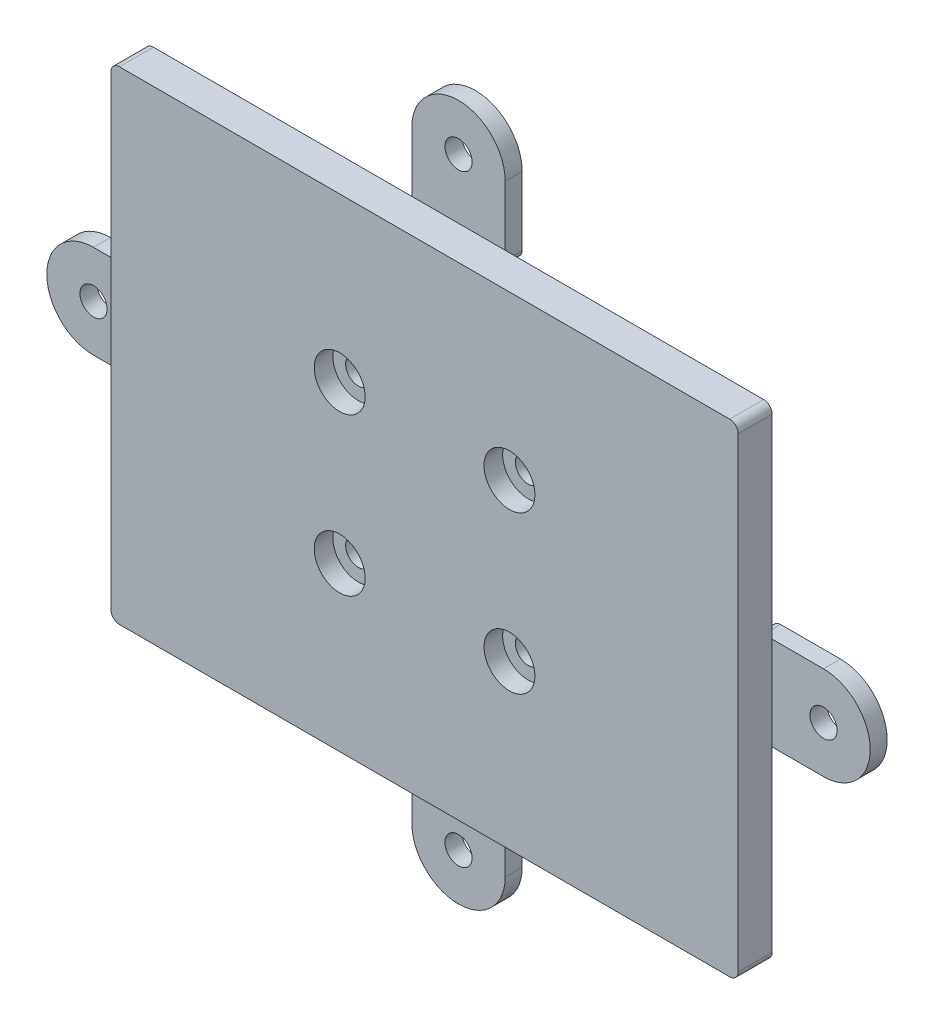
from build123d import *

# Parameters (mm, degrees)
SKETCH_1_W                = 73.9
SKETCH_1_H                = 56.9
EXTRUDE_1_DEPTH           = 4
HOLE_WIZARD_1_D           = 3
HOLE_WIZARD_1_CBORE_D     = 6
HOLE_WIZARD_1_CBORE_DEPTH = 2.2
SKETCH_4_W                = 7
SKETCH_4_H                = 25.95
SKETCH_4_W_2              = 33.45
SKETCH_4_H_2              = 7
SKETCH_4_H_3              = 23.95
EXTRUDE_2_DEPTH           = 2
HOLE_WIZARD_2_D           = 3.2
CHAMFER_1_SIZE            = 1
CHAMFER_1_SIZE_2          = 2
CHAMFER_2_SIZE            = 2
CHAMFER_2_SIZE_2          = 1
CHAMFER_3_SIZE            = 2
CHAMFER_3_SIZE_2          = 1
SKETCH_7_W                = 2
SKETCH_7_H                = 1
SKETCH_7_W_2              = 1
SKETCH_7_H_2              = 2
EXTRUDE_3_DEPTH           = 2
FILLET_3_R                = 1
FILLET_4_R                = 1


with BuildPart() as part:
    # 草图1 → 凸台-拉伸1 (new body)
    with BuildSketch(Plane.XY):
        Rectangle(SKETCH_1_W, SKETCH_1_H)
    extrude(amount=EXTRUDE_1_DEPTH)

    # 孔1 (through all)
    with Locations(Plane(origin=(-10, 9.25, 4), x_dir=(1, 0, 0), z_dir=(0, 0, 1))):
        with Locations((0, 0), (20, 0), (20, -18.5), (0, -18.5)):
            CounterBoreHole(HOLE_WIZARD_1_D / 2, HOLE_WIZARD_1_CBORE_D / 2, HOLE_WIZARD_1_CBORE_DEPTH)

    # 草图4 → 凸台-拉伸2 (add)
    with BuildSketch(Plane(origin=(0, 0, 0), x_dir=(-1, 0, 0), z_dir=(0, 0, -1))):
        with BuildLine():
            Line((3.5, 28.45), (3.5, 35.5))
            ThreePointArc((3.5, 35.5), (0, 39), (-3.5, 35.5))
            Line((-3.5, 35.5), (-3.5, 28.45))
            Line((-3.5, 28.45), (3.5, 28.45))
        make_face()
        with Locations((0, 15.475)):
            Rectangle(SKETCH_4_W, SKETCH_4_H)
        with Locations((20.225, -1)):
            Rectangle(SKETCH_4_W_2, SKETCH_4_H_2)
        with BuildLine():
            Line((43, 2.5), (36.95, 2.5))
            Line((36.95, 2.5), (36.95, -4.5))
            Line((36.95, -4.5), (43, -4.5))
            ThreePointArc((43, -4.5), (46.5, -1), (43, 2.5))
        make_face()
        with Locations((0, -1)):
            Rectangle(SKETCH_4_W, SKETCH_4_H_2)
        with Locations((-20.225, -1)):
            Rectangle(SKETCH_4_W_2, SKETCH_4_H_2)
        with Locations((0, -16.475)):
            Rectangle(SKETCH_4_W, SKETCH_4_H_3)
        with BuildLine():
            Line((-36.95, -4.5), (-36.95, 2.5))
            Line((-36.95, 2.5), (-43, 2.5))
            ThreePointArc((-43, 2.5), (-46.5, -1), (-43, -4.5))
            Line((-43, -4.5), (-36.95, -4.5))
        make_face()
        with BuildLine():
            Line((3.5, -35.5), (3.5, -28.45))
            Line((3.5, -28.45), (-3.5, -28.45))
            Line((-3.5, -28.45), (-3.5, -35.5))
            ThreePointArc((-3.5, -35.5), (0, -39), (3.5, -35.5))
        make_face()
    extrude(amount=EXTRUDE_2_DEPTH)

    # 孔2 (through all)
    with Locations(Plane(origin=(43, -1, -2), x_dir=(-1, 0, 0), z_dir=(0, 0, -1))):
        with Locations((0, 0), (43, 36.5), (86, 0), (43, -34.5)):
            Hole(HOLE_WIZARD_2_D / 2)

    # 倒角1
    # the kernel refuses this chamfer: 2, 1 mm, written as the material it adds along each edge
    with BuildSketch(Plane(origin=(-3.5, -2.679657748, 0), x_dir=(-0.9976223042390326, 0, 0.06891834360170879), z_dir=(0, 1, 0))) as chamfer_1_piece_1:
        Polygon((CHAMFER_1_SIZE * 0.997622304239, -CHAMFER_1_SIZE * 0.0689183436017), (-CHAMFER_1_SIZE_2 * 0.0689183436017, -CHAMFER_1_SIZE_2 * 0.997622304239), (0, 0), align=None)
    extrude(amount=31.129657748)
    with BuildSketch(Plane(origin=(-36.95, 2.5, 0), x_dir=(0, 0.9976223042390326, 0.06891834360170879), z_dir=(1, 0, 0))) as chamfer_1_piece_2:
        Polygon((CHAMFER_1_SIZE * 0.997622304239, -CHAMFER_1_SIZE * 0.0689183436017), (-CHAMFER_1_SIZE_2 * 0.0689183436017, -CHAMFER_1_SIZE_2 * 0.997622304239), (0, 0), align=None)
    extrude(amount=38.629657748)

    # 倒角2
    # the kernel refuses this chamfer: 2, 1 mm, written as the material it adds along each edge
    with BuildSketch(Plane(origin=(-3.5, 0.679657748, 0), x_dir=(0.017268075123668084, 0, -0.9998508956747119), z_dir=(0, -1, 0))) as chamfer_2_piece_1:
        Polygon((CHAMFER_2_SIZE * 0.999850895675, -CHAMFER_2_SIZE * 0.0172680751237), (-CHAMFER_2_SIZE_2 * 0.0172680751237, -CHAMFER_2_SIZE_2 * 0.999850895675), (0, 0), align=None)
    extrude(amount=29.129657748)
    with BuildSketch(Plane(origin=(-36.95, -4.5, 0), x_dir=(0, 0.017268075123667872, -0.9998508956747119), z_dir=(1, 0, 0))) as chamfer_2_piece_2:
        Polygon((CHAMFER_2_SIZE * 0.999850895675, -CHAMFER_2_SIZE * 0.0172680751237), (-CHAMFER_2_SIZE_2 * 0.0172680751237, -CHAMFER_2_SIZE_2 * 0.999850895675), (0, 0), align=None)
    extrude(amount=38.629657748)

    # 倒角3
    # the kernel refuses this chamfer: 2, 1 mm, written as the material it adds along each edge
    with BuildSketch(Plane(origin=(3.5, -28.45, 0), x_dir=(-0.0172680751236683, 0, -0.9998508956747119), z_dir=(0, 1, 0))) as chamfer_3_piece_1:
        Polygon((CHAMFER_3_SIZE * 0.999850895675, -CHAMFER_3_SIZE * 0.0172680751237), (-CHAMFER_3_SIZE_2 * 0.0172680751237, -CHAMFER_3_SIZE_2 * 0.999850895675), (0, 0), align=None)
    extrude(amount=29.129657748)
    with BuildSketch(Plane(origin=(-1.679657748, -4.5, 0), x_dir=(0, 0.0172680751236683, -0.9998508956747119), z_dir=(1, 0, 0)), Plane(origin=(36.95, 2.5, 0), x_dir=(0, -0.017268075123667872, -0.9998508956747119), z_dir=(-1, 0, 0))) as chamfer_3_piece_2:
        Polygon((CHAMFER_3_SIZE * 0.999850895675, -CHAMFER_3_SIZE * 0.0172680751237), (-CHAMFER_3_SIZE_2 * 0.0172680751237, -CHAMFER_3_SIZE_2 * 0.999850895675), (0, 0), align=None)
    extrude(amount=38.629657748)
    with BuildSketch(Plane(origin=(3.5, -2.679657748, 0), x_dir=(-0.017268075123668084, 0, -0.9998508956747119), z_dir=(0, 1, 0))) as chamfer_3_piece_3:
        Polygon((CHAMFER_3_SIZE * 0.999850895675, -CHAMFER_3_SIZE * 0.0172680751237), (-CHAMFER_3_SIZE_2 * 0.0172680751237, -CHAMFER_3_SIZE_2 * 0.999850895675), (0, 0), align=None)
    extrude(amount=31.129657748)

    # 草图7 → 凸台-拉伸3 (add)
    # profile 1 of 6: a face of its own
    with BuildSketch(Plane(origin=(0, 0, 0), x_dir=(-1, 0, 0), z_dir=(0, 0, -1))):
        with BuildLine():
            Line((-36.95, 4.5), (-43, 4.5))
            ThreePointArc((-43, 4.5), (-48.5, -1), (-43, -6.5))
            Line((-43, -6.5), (-34.95, -6.5))
            Line((-34.95, -6.5), (-34.95, 3.5))
            Line((-34.95, 3.5), (-36.95, 3.5))
            Line((-36.95, 3.5), (-36.95, 4.5))
        make_face()
        with BuildLine():
            Line((-43, 2.5), (-36.95, 2.5))
            Line((-36.95, 2.5), (-36.95, -4.5))
            Line((-36.95, -4.5), (-43, -4.5))
            ThreePointArc((-43, -4.5), (-46.5, -1), (-43, 2.5))
        make_face(mode=Mode.SUBTRACT)
    # profile 2 of 6: a face of its own
    with BuildSketch(Plane(origin=(0, 0, 0), x_dir=(-1, 0, 0), z_dir=(0, 0, -1))):
        with Locations((-35.95, 4)):
            Rectangle(SKETCH_7_W, SKETCH_7_H)
    # profile 3 of 6: a face of its own
    with BuildSketch(Plane(origin=(0, 0, 0), x_dir=(-1, 0, 0), z_dir=(0, 0, -1))):
        with BuildLine():
            Line((-5.5, -35.5), (-5.5, -26.45))
            Line((-5.5, -26.45), (5.5, -26.45))
            Line((5.5, -26.45), (5.5, -35.5))
            ThreePointArc((5.5, -35.5), (0, -41), (-5.5, -35.5))
        make_face()
        with BuildLine():
            ThreePointArc((-3.5, -35.5), (0, -39), (3.5, -35.5))
            Line((3.5, -35.5), (3.5, -28.45))
            Line((3.5, -28.45), (-3.5, -28.45))
            Line((-3.5, -28.45), (-3.5, -35.5))
        make_face(mode=Mode.SUBTRACT)
    # profile 4 of 6: a face of its own
    with BuildSketch(Plane(origin=(0, 0, 0), x_dir=(-1, 0, 0), z_dir=(0, 0, -1))):
        with BuildLine():
            Line((43, -6.5), (34.95, -6.5))
            Line((34.95, -6.5), (34.95, 4.5))
            Line((34.95, 4.5), (43, 4.5))
            ThreePointArc((43, 4.5), (48.5, -1), (43, -6.5))
        make_face()
        with BuildLine():
            ThreePointArc((43, -4.5), (46.5, -1), (43, 2.5))
            Line((43, 2.5), (36.95, 2.5))
            Line((36.95, 2.5), (36.95, -4.5))
            Line((36.95, -4.5), (43, -4.5))
        make_face(mode=Mode.SUBTRACT)
    # profile 5 of 6: a face of its own
    with BuildSketch(Plane(origin=(0, 0, 0), x_dir=(-1, 0, 0), z_dir=(0, 0, -1))):
        with BuildLine():
            Line((-5.5, 35.5), (-5.5, 28.45))
            Line((-5.5, 28.45), (-4.5, 28.45))
            Line((-4.5, 28.45), (-4.5, 26.45))
            Line((-4.5, 26.45), (5.5, 26.45))
            Line((5.5, 26.45), (5.5, 35.5))
            ThreePointArc((5.5, 35.5), (0, 41), (-5.5, 35.5))
        make_face()
        with BuildLine():
            Line((3.5, 35.5), (3.5, 28.45))
            Line((3.5, 28.45), (-3.5, 28.45))
            Line((-3.5, 28.45), (-3.5, 35.5))
            ThreePointArc((-3.5, 35.5), (0, 39), (3.5, 35.5))
        make_face(mode=Mode.SUBTRACT)
    # profile 6 of 6: a face of its own
    with BuildSketch(Plane(origin=(0, 0, 0), x_dir=(-1, 0, 0), z_dir=(0, 0, -1))):
        with Locations((-5, 27.45)):
            Rectangle(SKETCH_7_W_2, SKETCH_7_H_2)
    extrude(amount=EXTRUDE_3_DEPTH)

    # 圆角3
    fillet_3_edges = [part.edges().sort_by_distance(p)[0] for p in [
        (-34.95, -6.5, -1),
        (-34.95, 4.5, -1),
        (5.5, -26.45, -1),
        (-5.5, -26.45, -1),
        (-5.5, 26.45, -1),
        (5.5, 26.45, -1),
        (34.95, 4.5, -1),
        (34.95, -6.5, -1),
    ]]
    fillet(fillet_3_edges, radius=FILLET_3_R)

    # 圆角4
    fillet_4_edges = [part.edges().sort_by_distance(p)[0] for p in [
        (36.95, -28.45, 2),
        (-36.95, -28.45, 2),
        (-36.95, 28.45, 2),
        (36.95, 28.45, 2),
    ]]
    fillet(fillet_4_edges, radius=FILLET_4_R)


solid = part.part
